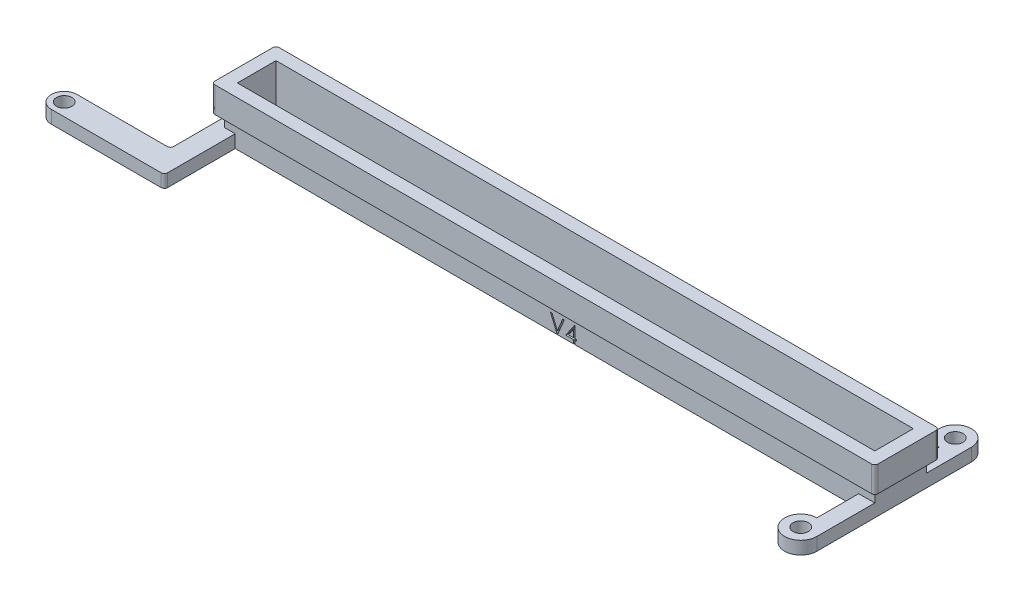
from build123d import *

# Parameters (mm, degrees)
SKETCH1_W           = 101
SKETCH1_H           = 8
SKETCH1_W_2         = 99
SKETCH1_H_2         = 6
BOSS_EXTRUDE1_DEPTH = 10
SKETCH2_R           = 1.2
BOSS_EXTRUDE2_DEPTH = 2
SKETCH3_W           = 103
SKETCH3_H           = 10
SKETCH3_W_2         = 101
SKETCH3_H_2         = 8
BOSS_EXTRUDE3_DEPTH = 6
FILLET4_R           = 1
FILLET5_R           = 1
FILLET6_R           = 1
FILLET7_R           = 1
FILLET8_R           = 0.5
FILLET9_R           = 0.5
CUT_EXTRUDE1_DEPTH  = 2
CUT_EXTRUDE2_DEPTH  = 0.5


# Some blends are built 0.0001 mm under size
with BuildPart() as part:
    # Sketch1 → Boss-Extrude1 (new body)
    with BuildSketch(Plane(origin=(0, 0, 0), x_dir=(1, 0, 0), z_dir=(0, 1, 0))):
        Rectangle(SKETCH1_W, SKETCH1_H)
        Rectangle(SKETCH1_W_2, SKETCH1_H_2, mode=Mode.SUBTRACT)
    extrude(amount=BOSS_EXTRUDE1_DEPTH)

    # Sketch2 → Boss-Extrude2 (add)
    # profile 1 of 3: a face of its own
    with BuildSketch(Plane.XZ):
        with BuildLine():
            Line((48, 4), (50.5, 4))
            Line((50.5, 4), (50.5, 13))
            ThreePointArc((50.5, 13), (46.232233047, 14.767766953), (48, 10.5))
            Line((48, 10.5), (48, 4))
        make_face()
        with Locations(Location((48, 13, 0), (0, 0, 270))):
            Circle(SKETCH2_R, mode=Mode.SUBTRACT)
    # profile 2 of 3: a face of its own
    with BuildSketch(Plane.XZ):
        with BuildLine():
            Line((48, -4), (50.5, -4))
            Line((50.5, -4), (50.5, -11))
            ThreePointArc((50.5, -11), (46.232233047, -12.767766953), (48, -8.5))
            Line((48, -8.5), (48, -4))
        make_face()
        with Locations(Location((48, -11, 0), (0, 0, 270))):
            Circle(SKETCH2_R, mode=Mode.SUBTRACT)
    # profile 3 of 3: a face of its own
    with BuildSketch(Plane.XZ):
        with BuildLine():
            Line((-66.4, 15), (-48.835058433, 15))
            Line((-48.835058433, 15), (-48.835058433, 4))
            Line((-48.835058433, 4), (-50.5, 4))
            Line((-50.5, 4), (-50.5, -4))
            Line((-50.5, -4), (-51.901659191, -4))
            Line((-51.901659191, -4), (-51.901659191, 11))
            Line((-51.901659191, 11), (-66.4, 11))
            ThreePointArc((-66.4, 11), (-68.4, 13), (-66.4, 15))
        make_face()
        with Locations(Location((-66.4, 13, 0), (0, 0, 270))):
            Circle(SKETCH2_R, mode=Mode.SUBTRACT)
    extrude(amount=-BOSS_EXTRUDE2_DEPTH)

    # Sketch3 → Boss-Extrude3 (add)
    with BuildSketch(Plane(origin=(0, 10, 0), x_dir=(1, 0, 0), z_dir=(0, 1, 0))):
        Rectangle(SKETCH3_W, SKETCH3_H)
        Rectangle(SKETCH3_W_2, SKETCH3_H_2, mode=Mode.SUBTRACT)
    extrude(amount=-BOSS_EXTRUDE3_DEPTH)

    # Fillet4
    fillet4_edges = [part.edges().sort_by_distance(p)[0] for p in [
        (0, 4, -4),
    ]]
    fillet(fillet4_edges, radius=FILLET4_R - 0.0001)  # a hair under: the kernel refuses the full size

    # Fillet5
    fillet5_edges = [part.edges().sort_by_distance(p)[0] for p in [
        (0, 4, 4),
    ]]
    fillet(fillet5_edges, radius=FILLET5_R - 0.0001)  # a hair under: the kernel refuses the full size

    # Fillet6
    fillet6_edges = [part.edges().sort_by_distance(p)[0] for p in [
        (50.5, 4, 0),
    ]]
    fillet(fillet6_edges, radius=FILLET6_R - 0.0001)  # a hair under: the kernel refuses the full size

    # Fillet7
    fillet7_edges = [part.edges().sort_by_distance(p)[0] for p in [
        (-50.5, 4, 0),
    ]]
    fillet(fillet7_edges, radius=FILLET7_R - 0.0001)  # a hair under: the kernel refuses the full size

    # Fillet8
    fillet8_edges = [part.edges().sort_by_distance(p)[0] for p in [
        (-51.901659191, 1, 11),
        (-48.835058433, 1, 15),
    ]]
    fillet(fillet8_edges, radius=FILLET8_R)

    # Fillet9
    # the kernel refuses this fillet: 0.5 mm, written as the material it takes off along each edge
    with BuildSketch(Plane(origin=(51.5, 11.25, -5), x_dir=(-1, 0, 0), z_dir=(0, -1, 0))) as fillet9_piece_1:
        with BuildLine():
            CenterArc((FILLET9_R, -FILLET9_R), FILLET9_R, 90, 90)
            Line((0, -FILLET9_R), (0, 0))
            Line((0, 0), (FILLET9_R, 0))
        make_face()
    extrude(amount=8.5, mode=Mode.SUBTRACT)
    with BuildSketch(Plane(origin=(51.5, 11.25, 5), x_dir=(-1, 0, 0), z_dir=(0, -1, 0)), Plane(origin=(-51.5, 11.25, 5), x_dir=(0, 0, -1), z_dir=(0, -1, 0)), Plane(origin=(-51.5, 11.25, -5), x_dir=(1, 0, 0), z_dir=(0, -1, 0))) as fillet9_piece_2:
        with BuildLine():
            CenterArc((FILLET9_R, FILLET9_R), FILLET9_R, 180, 90)
            Line((0, FILLET9_R), (0, 0))
            Line((0, 0), (FILLET9_R, 0))
        make_face()
    extrude(amount=8.5, mode=Mode.SUBTRACT)

    # Sketch4 → Cut-Extrude1 (cut)
    with BuildSketch(Plane(origin=(0, 10, 0), x_dir=(1, 0, 0), z_dir=(0, 1, 0))):
        with BuildLine():
            Line((51.5, -4.5), (51.5, 4.5))
            ThreePointArc((51.5, 4.5), (51.353553391, 4.853553391), (51, 5))
            Line((51, 5), (-51, 5))
            ThreePointArc((-51, 5), (-51.353553391, 4.853553391), (-51.5, 4.5))
            Line((-51.5, 4.5), (-51.5, -4.5))
            ThreePointArc((-51.5, -4.5), (-51.353553391, -4.853553391), (-51, -5))
            Line((-51, -5), (51, -5))
            ThreePointArc((51, -5), (51.353553391, -4.853553391), (51.5, -4.5))
        make_face()
    extrude(amount=-CUT_EXTRUDE1_DEPTH, mode=Mode.SUBTRACT)

    # Sketch5 → Cut-Extrude2 (cut)
    # profile 1 of 2: a face of its own
    with BuildSketch(Plane.XY.offset(4)):
        Polygon((0.128205128, 2.5), (0.368589744, 2.5), (1.201923077, 0.529847756), (2.03525641, 2.5), (2.275641026, 2.5), (1.217948718, 0), (1.185897436, 0), align=None)
    # profile 2 of 2: a face of its own
    with BuildSketch(Plane.XY.offset(4)):
        Polygon((3.864683494, 2.564102564), (3.91025641, 2.564102564), (3.91025641, 0.833333333), (4.198717949, 0.833333333), (4.198717949, 0.576923077), (3.91025641, 0.576923077), (3.91025641, 0), (3.685897436, 0), (3.685897436, 0.576923077), (2.5, 0.576923077), align=None)
        Polygon((3.685897436, 0.833333333), (3.685897436, 1.919070513), (2.940705128, 0.833333333), align=None, mode=Mode.SUBTRACT)
    extrude(amount=-CUT_EXTRUDE2_DEPTH, mode=Mode.SUBTRACT)


solid = part.part
